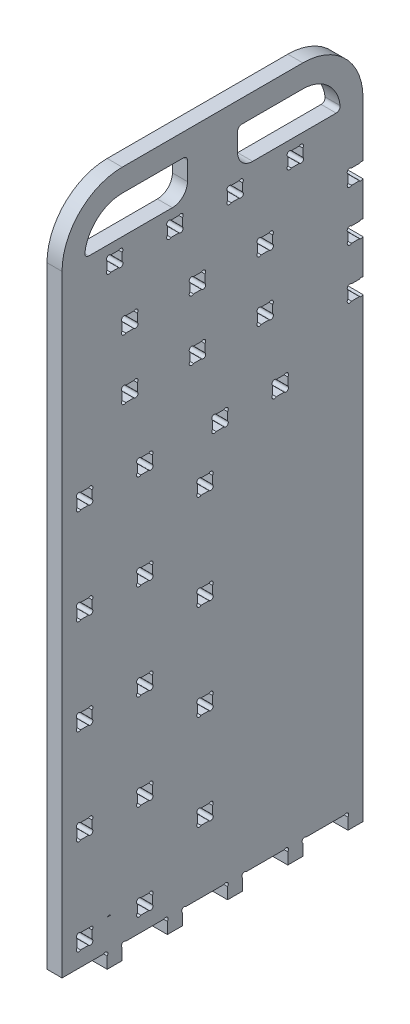
from build123d import *

# Parameters (mm, degrees)
BOSS_EXTRUDE1_DEPTH     = 19.05
CUT_EXTRUDE2_DEPTH      = 950.914156648
LPATTERN1_COUNT         = 5
LPATTERN1_PITCH         = 76.2
BOSS_EXTRUDE2_DEPTH     = 19.05
FILLET2_R               = 5.08
CUT_EXTRUDE3_DEPTH      = 950.914156648
CUT_EXTRUDE3_DEPTH_BACK = 950.914156648
FILLET3_R               = 19.05
SKETCH8_R               = 3.81
CUT_EXTRUDE4_DEPTH      = 45.72
BOSS_EXTRUDE3_START     = -19.05
SKETCH9_R               = 3.81
BOSS_EXTRUDE3_DEPTH     = 19.05
CUT_EXTRUDE5_DEPTH      = 950.914156648
CUT_EXTRUDE5_DEPTH_BACK = 950.914156648
CUT_EXTRUDE6_DEPTH      = 950.914156648
CUT_EXTRUDE6_DEPTH_BACK = 950.914156648
CUT_EXTRUDE7_DEPTH      = 950.914156648
CUT_EXTRUDE7_DEPTH_BACK = 950.914156648
BOSS_EXTRUDE4_START     = -19.05
BOSS_EXTRUDE4_DEPTH     = 19.05


with BuildPart() as part:
    # Sketch1 → Boss-Extrude1 (new body)
    with BuildSketch(Plane(origin=(0, 0, 0), x_dir=(0, 0, -1), z_dir=(1, 0, 0))):
        with BuildLine():
            Line((0, 793.75), (0, 0))
            Line((0, 0), (381, 0))
            Line((381, 0), (381, 793.75))
            ThreePointArc((381, 793.75), (358.681536726, 847.631536726), (304.8, 869.95))
            Line((304.8, 869.95), (76.2, 869.95))
            ThreePointArc((76.2, 869.95), (22.318463274, 847.631536726), (0, 793.75))
        make_face()
        with BuildLine():
            Line((57.15, 42.590128061), (57.15, 52.659871939))
            ThreePointArc((57.15, 52.659871939), (57.15, 57.15), (61.640128061, 57.15))
            Line((61.640128061, 57.15), (71.709871939, 57.15))
            ThreePointArc((71.709871939, 57.15), (76.2, 57.15), (76.2, 52.659871939))
            Line((76.2, 52.659871939), (76.2, 42.590128061))
            ThreePointArc((76.2, 42.590128061), (76.2, 38.1), (71.709871939, 38.1))
            Line((71.709871939, 38.1), (61.640128061, 38.1))
            ThreePointArc((61.640128061, 38.1), (57.15, 38.1), (57.15, 42.590128061))
        make_face(mode=Mode.SUBTRACT)
        with BuildLine():
            Line((76.2, 173.309871939), (76.2, 163.240128061))
            ThreePointArc((76.2, 163.240128061), (76.2, 158.75), (71.709871939, 158.75))
            Line((71.709871939, 158.75), (61.640128061, 158.75))
            ThreePointArc((61.640128061, 158.75), (57.15, 158.75), (57.15, 163.240128061))
            Line((57.15, 163.240128061), (57.15, 173.309871939))
            ThreePointArc((57.15, 173.309871939), (57.15, 177.8), (61.640128061, 177.8))
            Line((61.640128061, 177.8), (71.709871939, 177.8))
            ThreePointArc((71.709871939, 177.8), (76.2, 177.8), (76.2, 173.309871939))
        make_face(mode=Mode.SUBTRACT)
        with BuildLine():
            Line((137.840128061, 57.15), (147.909871939, 57.15))
            ThreePointArc((147.909871939, 57.15), (152.4, 57.15), (152.4, 52.659871939))
            Line((152.4, 52.659871939), (152.4, 42.590128061))
            ThreePointArc((152.4, 42.590128061), (152.4, 38.1), (147.909871939, 38.1))
            Line((147.909871939, 38.1), (137.840128061, 38.1))
            ThreePointArc((137.840128061, 38.1), (133.35, 38.1), (133.35, 42.590128061))
            Line((133.35, 42.590128061), (133.35, 52.659871939))
            ThreePointArc((133.35, 52.659871939), (133.35, 57.15), (137.840128061, 57.15))
        make_face(mode=Mode.SUBTRACT)
        with BuildLine():
            Line((171.45, 102.915128061), (171.45, 112.984871939))
            ThreePointArc((171.45, 112.984871939), (171.45, 117.475), (175.940128061, 117.475))
            Line((175.940128061, 117.475), (186.009871939, 117.475))
            ThreePointArc((186.009871939, 117.475), (190.5, 117.475), (190.5, 112.984871939))
            Line((190.5, 112.984871939), (190.5, 102.915128061))
            ThreePointArc((190.5, 102.915128061), (190.5, 98.425), (186.009871939, 98.425))
            Line((186.009871939, 98.425), (175.940128061, 98.425))
            ThreePointArc((175.940128061, 98.425), (171.45, 98.425), (171.45, 102.915128061))
        make_face(mode=Mode.SUBTRACT)
        with BuildLine():
            Line((152.4, 173.309871939), (152.4, 163.240128061))
            ThreePointArc((152.4, 163.240128061), (152.4, 158.75), (147.909871939, 158.75))
            Line((147.909871939, 158.75), (137.840128061, 158.75))
            ThreePointArc((137.840128061, 158.75), (133.35, 158.75), (133.35, 163.240128061))
            Line((133.35, 163.240128061), (133.35, 173.309871939))
            ThreePointArc((133.35, 173.309871939), (133.35, 177.8), (137.840128061, 177.8))
            Line((137.840128061, 177.8), (147.909871939, 177.8))
            ThreePointArc((147.909871939, 177.8), (152.4, 177.8), (152.4, 173.309871939))
        make_face(mode=Mode.SUBTRACT)
        with BuildLine():
            Line((190.5, 233.634871939), (190.5, 223.565128061))
            ThreePointArc((190.5, 223.565128061), (190.5, 219.075), (186.009871939, 219.075))
            Line((186.009871939, 219.075), (175.940128061, 219.075))
            ThreePointArc((175.940128061, 219.075), (171.45, 219.075), (171.45, 223.565128061))
            Line((171.45, 223.565128061), (171.45, 233.634871939))
            ThreePointArc((171.45, 233.634871939), (171.45, 238.125), (175.940128061, 238.125))
            Line((175.940128061, 238.125), (186.009871939, 238.125))
            ThreePointArc((186.009871939, 238.125), (190.5, 238.125), (190.5, 233.634871939))
        make_face(mode=Mode.SUBTRACT)
        with BuildLine():
            Line((76.2, 293.959871939), (76.2, 283.890128061))
            ThreePointArc((76.2, 283.890128061), (76.2, 279.4), (71.709871939, 279.4))
            Line((71.709871939, 279.4), (61.640128061, 279.4))
            ThreePointArc((61.640128061, 279.4), (57.15, 279.4), (57.15, 283.890128061))
            Line((57.15, 283.890128061), (57.15, 293.959871939))
            ThreePointArc((57.15, 293.959871939), (57.15, 298.45), (61.640128061, 298.45))
            Line((61.640128061, 298.45), (71.709871939, 298.45))
            ThreePointArc((71.709871939, 298.45), (76.2, 298.45), (76.2, 293.959871939))
        make_face(mode=Mode.SUBTRACT)
        with BuildLine():
            ThreePointArc((76.2, 404.540128061), (76.2, 400.05), (71.709871939, 400.05))
            Line((71.709871939, 400.05), (61.640128061, 400.05))
            ThreePointArc((61.640128061, 400.05), (57.15, 400.05), (57.15, 404.540128061))
            Line((57.15, 404.540128061), (57.15, 414.609871939))
            ThreePointArc((57.15, 414.609871939), (57.15, 419.1), (61.640128061, 419.1))
            Line((61.640128061, 419.1), (71.709871939, 419.1))
            ThreePointArc((71.709871939, 419.1), (76.2, 419.1), (76.2, 414.609871939))
            Line((76.2, 414.609871939), (76.2, 404.540128061))
        make_face(mode=Mode.SUBTRACT)
        with BuildLine():
            Line((152.4, 293.959871939), (152.4, 283.890128061))
            ThreePointArc((152.4, 283.890128061), (152.4, 279.4), (147.909871939, 279.4))
            Line((147.909871939, 279.4), (137.840128061, 279.4))
            ThreePointArc((137.840128061, 279.4), (133.35, 279.4), (133.35, 283.890128061))
            Line((133.35, 283.890128061), (133.35, 293.959871939))
            ThreePointArc((133.35, 293.959871939), (133.35, 298.45), (137.840128061, 298.45))
            Line((137.840128061, 298.45), (147.909871939, 298.45))
            ThreePointArc((147.909871939, 298.45), (152.4, 298.45), (152.4, 293.959871939))
        make_face(mode=Mode.SUBTRACT)
        with BuildLine():
            ThreePointArc((152.4, 404.540128061), (152.4, 400.05), (147.909871939, 400.05))
            Line((147.909871939, 400.05), (137.840128061, 400.05))
            ThreePointArc((137.840128061, 400.05), (133.35, 400.05), (133.35, 404.540128061))
            Line((133.35, 404.540128061), (133.35, 414.609871939))
            ThreePointArc((133.35, 414.609871939), (133.35, 419.1), (137.840128061, 419.1))
            Line((137.840128061, 419.1), (147.909871939, 419.1))
            ThreePointArc((147.909871939, 419.1), (152.4, 419.1), (152.4, 414.609871939))
            Line((152.4, 414.609871939), (152.4, 404.540128061))
        make_face(mode=Mode.SUBTRACT)
        with BuildLine():
            Line((190.5, 354.284871939), (190.5, 344.215128061))
            ThreePointArc((190.5, 344.215128061), (190.5, 339.725), (186.009871939, 339.725))
            Line((186.009871939, 339.725), (175.940128061, 339.725))
            ThreePointArc((175.940128061, 339.725), (171.45, 339.725), (171.45, 344.215128061))
            Line((171.45, 344.215128061), (171.45, 354.284871939))
            ThreePointArc((171.45, 354.284871939), (171.45, 358.775), (175.940128061, 358.775))
            Line((175.940128061, 358.775), (186.009871939, 358.775))
            ThreePointArc((186.009871939, 358.775), (190.5, 358.775), (190.5, 354.284871939))
        make_face(mode=Mode.SUBTRACT)
        with BuildLine():
            Line((61.640128061, 539.75), (71.709871939, 539.75))
            ThreePointArc((71.709871939, 539.75), (76.2, 539.75), (76.2, 535.259871939))
            Line((76.2, 535.259871939), (76.2, 525.190128061))
            ThreePointArc((76.2, 525.190128061), (76.2, 520.7), (71.709871939, 520.7))
            Line((71.709871939, 520.7), (61.640128061, 520.7))
            ThreePointArc((61.640128061, 520.7), (57.15, 520.7), (57.15, 525.190128061))
            Line((57.15, 525.190128061), (57.15, 535.259871939))
            ThreePointArc((57.15, 535.259871939), (57.15, 539.75), (61.640128061, 539.75))
        make_face(mode=Mode.SUBTRACT)
        with BuildLine():
            Line((137.840128061, 539.75), (147.909871939, 539.75))
            ThreePointArc((147.909871939, 539.75), (152.4, 539.75), (152.4, 535.259871939))
            Line((152.4, 535.259871939), (152.4, 525.190128061))
            ThreePointArc((152.4, 525.190128061), (152.4, 520.7), (147.909871939, 520.7))
            Line((147.909871939, 520.7), (137.840128061, 520.7))
            ThreePointArc((137.840128061, 520.7), (133.35, 520.7), (133.35, 525.190128061))
            Line((133.35, 525.190128061), (133.35, 535.259871939))
            ThreePointArc((133.35, 535.259871939), (133.35, 539.75), (137.840128061, 539.75))
        make_face(mode=Mode.SUBTRACT)
        with BuildLine():
            Line((190.5, 474.934871939), (190.5, 464.865128061))
            ThreePointArc((190.5, 464.865128061), (190.5, 460.375), (186.009871939, 460.375))
            Line((186.009871939, 460.375), (175.940128061, 460.375))
            ThreePointArc((175.940128061, 460.375), (171.45, 460.375), (171.45, 464.865128061))
            Line((171.45, 464.865128061), (171.45, 474.934871939))
            ThreePointArc((171.45, 474.934871939), (171.45, 479.425), (175.940128061, 479.425))
            Line((175.940128061, 479.425), (186.009871939, 479.425))
            ThreePointArc((186.009871939, 479.425), (190.5, 479.425), (190.5, 474.934871939))
        make_face(mode=Mode.SUBTRACT)
        with BuildLine():
            Line((61.640128061, 781.05), (71.709871939, 781.05))
            ThreePointArc((71.709871939, 781.05), (76.2, 781.05), (76.2, 776.559871939))
            Line((76.2, 776.559871939), (76.2, 766.490128061))
            ThreePointArc((76.2, 766.490128061), (76.2, 762), (71.709871939, 762))
            Line((71.709871939, 762), (61.640128061, 762))
            ThreePointArc((61.640128061, 762), (57.15, 762), (57.15, 766.490128061))
            Line((57.15, 766.490128061), (57.15, 776.559871939))
            ThreePointArc((57.15, 776.559871939), (57.15, 781.05), (61.640128061, 781.05))
        make_face(mode=Mode.SUBTRACT)
        with BuildLine():
            ThreePointArc((28.575, 793.75), (42.524039546, 827.425960454), (76.2, 841.375))
            Line((76.2, 841.375), (158.75, 841.375))
            Line((158.75, 841.375), (158.75, 793.75))
            Line((158.75, 793.75), (28.575, 793.75))
        make_face(mode=Mode.SUBTRACT)
        with BuildLine():
            Line((137.840128061, 781.05), (147.909871939, 781.05))
            ThreePointArc((147.909871939, 781.05), (152.4, 781.05), (152.4, 776.559871939))
            Line((152.4, 776.559871939), (152.4, 766.490128061))
            ThreePointArc((152.4, 766.490128061), (152.4, 762), (147.909871939, 762))
            Line((147.909871939, 762), (137.840128061, 762))
            ThreePointArc((137.840128061, 762), (133.35, 762), (133.35, 766.490128061))
            Line((133.35, 766.490128061), (133.35, 776.559871939))
            ThreePointArc((133.35, 776.559871939), (133.35, 781.05), (137.840128061, 781.05))
        make_face(mode=Mode.SUBTRACT)
        with BuildLine():
            Line((214.040128061, 781.05), (224.109871939, 781.05))
            ThreePointArc((224.109871939, 781.05), (228.6, 781.05), (228.6, 776.559871939))
            Line((228.6, 776.559871939), (228.6, 766.490128061))
            ThreePointArc((228.6, 766.490128061), (228.6, 762), (224.109871939, 762))
            Line((224.109871939, 762), (214.040128061, 762))
            ThreePointArc((214.040128061, 762), (209.55, 762), (209.55, 766.490128061))
            Line((209.55, 766.490128061), (209.55, 776.559871939))
            ThreePointArc((209.55, 776.559871939), (209.55, 781.05), (214.040128061, 781.05))
        make_face(mode=Mode.SUBTRACT)
        with BuildLine():
            Line((290.240128061, 781.05), (300.309871939, 781.05))
            ThreePointArc((300.309871939, 781.05), (304.8, 781.05), (304.8, 776.559871939))
            Line((304.8, 776.559871939), (304.8, 766.490128061))
            ThreePointArc((304.8, 766.490128061), (304.8, 762), (300.309871939, 762))
            Line((300.309871939, 762), (290.240128061, 762))
            ThreePointArc((290.240128061, 762), (285.75, 762), (285.75, 766.490128061))
            Line((285.75, 766.490128061), (285.75, 776.559871939))
            ThreePointArc((285.75, 776.559871939), (285.75, 781.05), (290.240128061, 781.05))
        make_face(mode=Mode.SUBTRACT)
        with BuildLine():
            Line((222.25, 793.75), (222.25, 841.375))
            Line((222.25, 841.375), (304.8, 841.375))
            ThreePointArc((304.8, 841.375), (338.475960454, 827.425960454), (352.425, 793.75))
            Line((352.425, 793.75), (222.25, 793.75))
        make_face(mode=Mode.SUBTRACT)
    extrude(amount=BOSS_EXTRUDE1_DEPTH)

    # Sketch4 → Cut-Extrude2 (cut, symmetric)
    with BuildSketch(Plane(origin=(19.05, 0, 0), x_dir=(0, 0, -1), z_dir=(1, 0, 0))):
        with BuildLine():
            Line((57.15, 14.559871939), (57.15, 4.490128061))
            Line((57.15, 4.490128061), (57.15, 0))
            Line((57.15, 0), (0, 0))
            Line((0, 0), (0, 14.559871939))
            ThreePointArc((0, 14.559871939), (0, 19.05), (4.490128061, 19.05))
            Line((4.490128061, 19.05), (52.659871939, 19.05))
            ThreePointArc((52.659871939, 19.05), (57.15, 19.05), (57.15, 14.559871939))
        make_face()
    cut_extrude2 = extrude(amount=CUT_EXTRUDE2_DEPTH, both=True, mode=Mode.SUBTRACT)

    # LPattern1: Cut-Extrude2 ×5
    with Locations(*[(0, 0, -i * LPATTERN1_PITCH) for i in range(1, LPATTERN1_COUNT)]):
        add(cut_extrude2, mode=Mode.SUBTRACT)

    # Sketch5 → Boss-Extrude2 (add)
    with BuildSketch(Plane(origin=(19.05, 0, 0), x_dir=(0, 0, -1), z_dir=(1, 0, 0))):
        with BuildLine():
            Line((0, 19.05), (4.490128061, 19.05))
            ThreePointArc((4.490128061, 19.05), (2.24506403, 19.97993597), (0, 19.05))
        make_face()
    extrude(amount=-BOSS_EXTRUDE2_DEPTH)

    # Fillet2
    fillet2_edges = [part.edges().sort_by_distance(p)[0] for p in [
        (9.525, 841.375, -158.75),
        (9.525, 793.75, -28.575),
        (9.525, 841.375, -222.25),
        (9.525, 793.75, -352.425),
    ]]
    fillet(fillet2_edges, radius=FILLET2_R)

    # Sketch6 → Cut-Extrude3 (cut, two sides: drawn at the far end of the back side and taken through both)
    with BuildSketch(Plane(origin=(19.05, 0, 0), x_dir=(0, 0, -1), z_dir=(1, 0, 0)).offset(-CUT_EXTRUDE3_DEPTH_BACK)):
        with BuildLine():
            Line((381, 645.840128061), (381, 655.909871939))
            ThreePointArc((381, 655.909871939), (381, 660.4), (376.509871939, 660.4))
            Line((376.509871939, 660.4), (366.440128061, 660.4))
            ThreePointArc((366.440128061, 660.4), (361.95, 660.4), (361.95, 655.909871939))
            Line((361.95, 655.909871939), (361.95, 645.840128061))
            ThreePointArc((361.95, 645.840128061), (361.95, 641.35), (366.440128061, 641.35))
            Line((366.440128061, 641.35), (376.509871939, 641.35))
            ThreePointArc((376.509871939, 641.35), (381, 641.35), (381, 645.840128061))
        make_face()
        with BuildLine():
            Line((381, 582.340128061), (381, 592.409871939))
            ThreePointArc((381, 592.409871939), (381, 596.9), (376.509871939, 596.9))
            Line((376.509871939, 596.9), (366.440128061, 596.9))
            ThreePointArc((366.440128061, 596.9), (361.95, 596.9), (361.95, 592.409871939))
            Line((361.95, 592.409871939), (361.95, 582.340128061))
            ThreePointArc((361.95, 582.340128061), (361.95, 577.85), (366.440128061, 577.85))
            Line((366.440128061, 577.85), (376.509871939, 577.85))
            ThreePointArc((376.509871939, 577.85), (381, 577.85), (381, 582.340128061))
        make_face()
        with BuildLine():
            Line((381, 709.340128061), (381, 719.409871939))
            ThreePointArc((381, 719.409871939), (381, 723.9), (376.509871939, 723.9))
            Line((376.509871939, 723.9), (366.440128061, 723.9))
            ThreePointArc((366.440128061, 723.9), (361.95, 723.9), (361.95, 719.409871939))
            Line((361.95, 719.409871939), (361.95, 709.340128061))
            ThreePointArc((361.95, 709.340128061), (361.95, 704.85), (366.440128061, 704.85))
            Line((366.440128061, 704.85), (376.509871939, 704.85))
            ThreePointArc((376.509871939, 704.85), (381, 704.85), (381, 709.340128061))
        make_face()
    extrude(amount=CUT_EXTRUDE3_DEPTH + CUT_EXTRUDE3_DEPTH_BACK, mode=Mode.SUBTRACT)

    # Fillet3
    fillet3_edges = [part.edges().sort_by_distance(p)[0] for p in [
        (9.525, 793.75, -158.75),
        (9.525, 793.75, -222.25),
    ]]
    fillet(fillet3_edges, radius=FILLET3_R)

    # Sketch8 → Cut-Extrude4 (cut)
    with BuildSketch(Plane(origin=(0, 0, 0), x_dir=(0, 0, -1), z_dir=(1, 0, 0))):
        with Locations((288.163831373, 502.508233844)):
            Circle(SKETCH8_R)
        with Locations((288.163831373, 322.168233844)):
            Circle(SKETCH8_R)
        with Locations((288.163831373, 231.849411281)):
            Circle(SKETCH8_R)
        with Locations((288.163831373, 51.509411281)):
            Circle(SKETCH8_R)
        with Locations((334.581915687, 28.649411281)):
            Circle(SKETCH8_R)
        with Locations((334.581915687, 257.249411281)):
            Circle(SKETCH8_R)
        with Locations(Location((334.581915687, 525.368233844, 0), (0, 0, 180))):
            Circle(SKETCH8_R)
        with Locations(Location((334.581915687, 296.768233844, 0), (0, 0, 180))):
            Circle(SKETCH8_R)
        with Locations(Location((241.74574706, 28.649411281, 0), (0, 0, 180))):
            Circle(SKETCH8_R)
        with Locations(Location((241.74574706, 257.249411281, 0), (0, 0, 180))):
            Circle(SKETCH8_R)
        with Locations((241.74574706, 296.768233844)):
            Circle(SKETCH8_R)
        with Locations((241.74574706, 525.368233844)):
            Circle(SKETCH8_R)
    extrude(amount=CUT_EXTRUDE4_DEPTH, mode=Mode.SUBTRACT)

    # Sketch9 → Boss-Extrude3 (add)
    with BuildSketch(Plane(origin=(19.05, 0, 0), x_dir=(0, 0, -1), z_dir=(1, 0, 0)).offset(BOSS_EXTRUDE3_START)):
        with Locations((241.74574706, 525.368233844)):
            Circle(SKETCH9_R)
        with Locations((334.581915687, 525.368233844)):
            Circle(SKETCH9_R)
        with Locations((288.163831373, 502.508233844)):
            Circle(SKETCH9_R)
        with Locations((241.74574706, 296.768233844)):
            Circle(SKETCH9_R)
        with Locations((334.581915687, 296.768233844)):
            Circle(SKETCH9_R)
        with Locations((288.163831373, 322.168233844)):
            Circle(SKETCH9_R)
        with Locations((241.74574706, 257.249411281)):
            Circle(SKETCH9_R)
        with Locations((288.163831373, 231.849411281)):
            Circle(SKETCH9_R)
        with Locations((334.581915687, 257.249411281)):
            Circle(SKETCH9_R)
        with Locations((241.74574706, 28.649411281)):
            Circle(SKETCH9_R)
        with Locations((288.163831373, 51.509411281)):
            Circle(SKETCH9_R)
        with Locations((334.581915687, 28.649411281)):
            Circle(SKETCH9_R)
    extrude(amount=BOSS_EXTRUDE3_DEPTH)

    # Sketch10 → Cut-Extrude5 (cut, two sides: drawn at the far end of the back side and taken through both)
    with BuildSketch(Plane.ZY.offset(-CUT_EXTRUDE5_DEPTH_BACK)):
        with BuildLine():
            Line((-90.759871939, 685.8), (-80.690128061, 685.8))
            ThreePointArc((-80.690128061, 685.8), (-76.2, 685.8), (-76.2, 690.290128061))
            Line((-76.2, 690.290128061), (-76.2, 700.359871939))
            ThreePointArc((-76.2, 700.359871939), (-76.2, 704.85), (-80.690128061, 704.85))
            Line((-80.690128061, 704.85), (-90.759871939, 704.85))
            ThreePointArc((-90.759871939, 704.85), (-95.25, 704.85), (-95.25, 700.359871939))
            Line((-95.25, 700.359871939), (-95.25, 690.290128061))
            ThreePointArc((-95.25, 690.290128061), (-95.25, 685.8), (-90.759871939, 685.8))
        make_face()
        with BuildLine():
            Line((-180.975, 690.290128061), (-180.975, 700.359871939))
            ThreePointArc((-180.975, 700.359871939), (-180.975, 704.85), (-176.484871939, 704.85))
            Line((-176.484871939, 704.85), (-166.415128061, 704.85))
            ThreePointArc((-166.415128061, 704.85), (-161.925, 704.85), (-161.925, 700.359871939))
            Line((-161.925, 700.359871939), (-161.925, 690.290128061))
            ThreePointArc((-161.925, 690.290128061), (-161.925, 685.8), (-166.415128061, 685.8))
            Line((-166.415128061, 685.8), (-176.484871939, 685.8))
            ThreePointArc((-176.484871939, 685.8), (-180.975, 685.8), (-180.975, 690.290128061))
        make_face()
        with BuildLine():
            Line((-266.7, 690.290128061), (-266.7, 700.359871939))
            ThreePointArc((-266.7, 700.359871939), (-266.7, 704.85), (-262.209871939, 704.85))
            Line((-262.209871939, 704.85), (-252.140128061, 704.85))
            ThreePointArc((-252.140128061, 704.85), (-247.65, 704.85), (-247.65, 700.359871939))
            Line((-247.65, 700.359871939), (-247.65, 690.290128061))
            ThreePointArc((-247.65, 690.290128061), (-247.65, 685.8), (-252.140128061, 685.8))
            Line((-252.140128061, 685.8), (-262.209871939, 685.8))
            ThreePointArc((-262.209871939, 685.8), (-266.7, 685.8), (-266.7, 690.290128061))
        make_face()
        with BuildLine():
            Line((-180.975, 614.090128061), (-180.975, 624.159871939))
            ThreePointArc((-180.975, 624.159871939), (-180.975, 628.65), (-176.484871939, 628.65))
            Line((-176.484871939, 628.65), (-166.415128061, 628.65))
            ThreePointArc((-166.415128061, 628.65), (-161.925, 628.65), (-161.925, 624.159871939))
            Line((-161.925, 624.159871939), (-161.925, 614.090128061))
            ThreePointArc((-161.925, 614.090128061), (-161.925, 609.6), (-166.415128061, 609.6))
            Line((-166.415128061, 609.6), (-176.484871939, 609.6))
            ThreePointArc((-176.484871939, 609.6), (-180.975, 609.6), (-180.975, 614.090128061))
        make_face()
        with BuildLine():
            Line((-266.7, 614.090128061), (-266.7, 624.159871939))
            ThreePointArc((-266.7, 624.159871939), (-266.7, 628.65), (-262.209871939, 628.65))
            Line((-262.209871939, 628.65), (-252.140128061, 628.65))
            ThreePointArc((-252.140128061, 628.65), (-247.65, 628.65), (-247.65, 624.159871939))
            Line((-247.65, 624.159871939), (-247.65, 614.090128061))
            ThreePointArc((-247.65, 614.090128061), (-247.65, 609.6), (-252.140128061, 609.6))
            Line((-252.140128061, 609.6), (-262.209871939, 609.6))
            ThreePointArc((-262.209871939, 609.6), (-266.7, 609.6), (-266.7, 614.090128061))
        make_face()
        with BuildLine():
            Line((-95.25, 614.090128061), (-95.25, 624.159871939))
            ThreePointArc((-95.25, 624.159871939), (-95.25, 628.65), (-90.759871939, 628.65))
            Line((-90.759871939, 628.65), (-80.690128061, 628.65))
            ThreePointArc((-80.690128061, 628.65), (-76.2, 628.65), (-76.2, 624.159871939))
            Line((-76.2, 624.159871939), (-76.2, 614.090128061))
            ThreePointArc((-76.2, 614.090128061), (-76.2, 609.6), (-80.690128061, 609.6))
            Line((-80.690128061, 609.6), (-90.759871939, 609.6))
            ThreePointArc((-90.759871939, 609.6), (-95.25, 609.6), (-95.25, 614.090128061))
        make_face()
    extrude(amount=CUT_EXTRUDE5_DEPTH + CUT_EXTRUDE5_DEPTH_BACK, mode=Mode.SUBTRACT)

    # Sketch11 → Cut-Extrude6 (cut, two sides: drawn at the far end of the back side and taken through both)
    with BuildSketch(Plane(origin=(19.05, 0, 0), x_dir=(0, 0, -1), z_dir=(1, 0, 0)).offset(-CUT_EXTRUDE6_DEPTH_BACK)):
        with BuildLine():
            Line((228.6, 525.190128061), (228.6, 535.259871939))
            ThreePointArc((228.6, 535.259871939), (228.6, 539.75), (233.090128061, 539.75))
            Line((233.090128061, 539.75), (243.159871939, 539.75))
            ThreePointArc((243.159871939, 539.75), (247.65, 539.75), (247.65, 535.259871939))
            Line((247.65, 535.259871939), (247.65, 525.190128061))
            ThreePointArc((247.65, 525.190128061), (247.65, 520.7), (243.159871939, 520.7))
            Line((243.159871939, 520.7), (233.090128061, 520.7))
            ThreePointArc((233.090128061, 520.7), (228.6, 520.7), (228.6, 525.190128061))
        make_face()
        with BuildLine():
            Line((304.8, 525.190128061), (304.8, 535.259871939))
            ThreePointArc((304.8, 535.259871939), (304.8, 539.75), (309.290128061, 539.75))
            Line((309.290128061, 539.75), (319.359871939, 539.75))
            ThreePointArc((319.359871939, 539.75), (323.85, 539.75), (323.85, 535.259871939))
            Line((323.85, 535.259871939), (323.85, 525.190128061))
            ThreePointArc((323.85, 525.190128061), (323.85, 520.7), (319.359871939, 520.7))
            Line((319.359871939, 520.7), (309.290128061, 520.7))
            ThreePointArc((309.290128061, 520.7), (304.8, 520.7), (304.8, 525.190128061))
        make_face()
    extrude(amount=CUT_EXTRUDE6_DEPTH + CUT_EXTRUDE6_DEPTH_BACK, mode=Mode.SUBTRACT)

    # Sketch12 → Cut-Extrude7 (cut, two sides: drawn at the far end of the back side and taken through both)
    with BuildSketch(Plane(origin=(19.05, 0, 0), x_dir=(0, 0, -1), z_dir=(1, 0, 0)).offset(-CUT_EXTRUDE7_DEPTH_BACK)):
        with BuildLine():
            Line((281.259871939, 539.75), (271.190128061, 539.75))
            ThreePointArc((271.190128061, 539.75), (266.7, 539.75), (266.7, 535.259871939))
            Line((266.7, 535.259871939), (266.7, 525.190128061))
            ThreePointArc((266.7, 525.190128061), (266.7, 520.7), (271.190128061, 520.7))
            Line((271.190128061, 520.7), (281.259871939, 520.7))
            ThreePointArc((281.259871939, 520.7), (285.75, 520.7), (285.75, 525.190128061))
            Line((285.75, 525.190128061), (285.75, 535.259871939))
            ThreePointArc((285.75, 535.259871939), (285.75, 539.75), (281.259871939, 539.75))
        make_face()
        with BuildLine():
            Line((194.990128061, 520.7), (205.059871939, 520.7))
            ThreePointArc((205.059871939, 520.7), (209.55, 520.7), (209.55, 525.190128061))
            Line((209.55, 525.190128061), (209.55, 535.259871939))
            ThreePointArc((209.55, 535.259871939), (209.55, 539.75), (205.059871939, 539.75))
            Line((205.059871939, 539.75), (194.990128061, 539.75))
            ThreePointArc((194.990128061, 539.75), (190.5, 539.75), (190.5, 535.259871939))
            Line((190.5, 535.259871939), (190.5, 525.190128061))
            ThreePointArc((190.5, 525.190128061), (190.5, 520.7), (194.990128061, 520.7))
        make_face()
        with BuildLine():
            Line((99.740128061, 520.7), (109.809871939, 520.7))
            ThreePointArc((109.809871939, 520.7), (114.3, 520.7), (114.3, 525.190128061))
            Line((114.3, 525.190128061), (114.3, 535.259871939))
            ThreePointArc((114.3, 535.259871939), (114.3, 539.75), (109.809871939, 539.75))
            Line((109.809871939, 539.75), (99.740128061, 539.75))
            ThreePointArc((99.740128061, 539.75), (95.25, 539.75), (95.25, 535.259871939))
            Line((95.25, 535.259871939), (95.25, 525.190128061))
            ThreePointArc((95.25, 525.190128061), (95.25, 520.7), (99.740128061, 520.7))
        make_face()
        with BuildLine():
            Line((23.540128061, 520.7), (33.609871939, 520.7))
            ThreePointArc((33.609871939, 520.7), (38.1, 520.7), (38.1, 525.190128061))
            Line((38.1, 525.190128061), (38.1, 535.259871939))
            ThreePointArc((38.1, 535.259871939), (38.1, 539.75), (33.609871939, 539.75))
            Line((33.609871939, 539.75), (23.540128061, 539.75))
            ThreePointArc((23.540128061, 539.75), (19.05, 539.75), (19.05, 535.259871939))
            Line((19.05, 535.259871939), (19.05, 525.190128061))
            ThreePointArc((19.05, 525.190128061), (19.05, 520.7), (23.540128061, 520.7))
        make_face()
        with BuildLine():
            Line((99.740128061, 400.05), (109.809871939, 400.05))
            ThreePointArc((109.809871939, 400.05), (114.3, 400.05), (114.3, 404.540128061))
            Line((114.3, 404.540128061), (114.3, 414.609871939))
            ThreePointArc((114.3, 414.609871939), (114.3, 419.1), (109.809871939, 419.1))
            Line((109.809871939, 419.1), (99.740128061, 419.1))
            ThreePointArc((99.740128061, 419.1), (95.25, 419.1), (95.25, 414.609871939))
            Line((95.25, 414.609871939), (95.25, 404.540128061))
            ThreePointArc((95.25, 404.540128061), (95.25, 400.05), (99.740128061, 400.05))
        make_face()
        with BuildLine():
            Line((23.540128061, 400.05), (33.609871939, 400.05))
            ThreePointArc((33.609871939, 400.05), (38.1, 400.05), (38.1, 404.540128061))
            Line((38.1, 404.540128061), (38.1, 414.609871939))
            ThreePointArc((38.1, 414.609871939), (38.1, 419.1), (33.609871939, 419.1))
            Line((33.609871939, 419.1), (23.540128061, 419.1))
            ThreePointArc((23.540128061, 419.1), (19.05, 419.1), (19.05, 414.609871939))
            Line((19.05, 414.609871939), (19.05, 404.540128061))
            ThreePointArc((19.05, 404.540128061), (19.05, 400.05), (23.540128061, 400.05))
        make_face()
        with BuildLine():
            Line((99.740128061, 279.4), (109.809871939, 279.4))
            ThreePointArc((109.809871939, 279.4), (114.3, 279.4), (114.3, 283.890128061))
            Line((114.3, 283.890128061), (114.3, 293.959871939))
            ThreePointArc((114.3, 293.959871939), (114.3, 298.45), (109.809871939, 298.45))
            Line((109.809871939, 298.45), (99.740128061, 298.45))
            ThreePointArc((99.740128061, 298.45), (95.25, 298.45), (95.25, 293.959871939))
            Line((95.25, 293.959871939), (95.25, 283.890128061))
            ThreePointArc((95.25, 283.890128061), (95.25, 279.4), (99.740128061, 279.4))
        make_face()
        with BuildLine():
            Line((23.540128061, 279.4), (33.609871939, 279.4))
            ThreePointArc((33.609871939, 279.4), (38.1, 279.4), (38.1, 283.890128061))
            Line((38.1, 283.890128061), (38.1, 293.959871939))
            ThreePointArc((38.1, 293.959871939), (38.1, 298.45), (33.609871939, 298.45))
            Line((33.609871939, 298.45), (23.540128061, 298.45))
            ThreePointArc((23.540128061, 298.45), (19.05, 298.45), (19.05, 293.959871939))
            Line((19.05, 293.959871939), (19.05, 283.890128061))
            ThreePointArc((19.05, 283.890128061), (19.05, 279.4), (23.540128061, 279.4))
        make_face()
        with BuildLine():
            Line((99.740128061, 158.75), (109.809871939, 158.75))
            ThreePointArc((109.809871939, 158.75), (114.3, 158.75), (114.3, 163.240128061))
            Line((114.3, 163.240128061), (114.3, 173.309871939))
            ThreePointArc((114.3, 173.309871939), (114.3, 177.8), (109.809871939, 177.8))
            Line((109.809871939, 177.8), (99.740128061, 177.8))
            ThreePointArc((99.740128061, 177.8), (95.25, 177.8), (95.25, 173.309871939))
            Line((95.25, 173.309871939), (95.25, 163.240128061))
            ThreePointArc((95.25, 163.240128061), (95.25, 158.75), (99.740128061, 158.75))
        make_face()
        with BuildLine():
            Line((23.540128061, 158.75), (33.609871939, 158.75))
            ThreePointArc((33.609871939, 158.75), (38.1, 158.75), (38.1, 163.240128061))
            Line((38.1, 163.240128061), (38.1, 173.309871939))
            ThreePointArc((38.1, 173.309871939), (38.1, 177.8), (33.609871939, 177.8))
            Line((33.609871939, 177.8), (23.540128061, 177.8))
            ThreePointArc((23.540128061, 177.8), (19.05, 177.8), (19.05, 173.309871939))
            Line((19.05, 173.309871939), (19.05, 163.240128061))
            ThreePointArc((19.05, 163.240128061), (19.05, 158.75), (23.540128061, 158.75))
        make_face()
        with BuildLine():
            Line((99.740128061, 38.1), (109.809871939, 38.1))
            ThreePointArc((109.809871939, 38.1), (114.3, 38.1), (114.3, 42.590128061))
            Line((114.3, 42.590128061), (114.3, 52.659871939))
            ThreePointArc((114.3, 52.659871939), (114.3, 57.15), (109.809871939, 57.15))
            Line((109.809871939, 57.15), (99.740128061, 57.15))
            ThreePointArc((99.740128061, 57.15), (95.25, 57.15), (95.25, 52.659871939))
            Line((95.25, 52.659871939), (95.25, 42.590128061))
            ThreePointArc((95.25, 42.590128061), (95.25, 38.1), (99.740128061, 38.1))
        make_face()
        with BuildLine():
            Line((38.1, 57.15), (33.609871939, 57.15))
            Line((33.609871939, 57.15), (23.540128061, 57.15))
            ThreePointArc((23.540128061, 57.15), (19.05, 57.15), (19.05, 52.659871939))
            Line((19.05, 52.659871939), (19.05, 42.590128061))
            ThreePointArc((19.05, 42.590128061), (19.05, 38.1), (23.540128061, 38.1))
            Line((23.540128061, 38.1), (33.609871939, 38.1))
            ThreePointArc((33.609871939, 38.1), (38.1, 38.1), (38.1, 42.590128061))
            Line((38.1, 42.590128061), (38.1, 52.659871939))
            ThreePointArc((38.1, 52.659871939), (39.02993597, 54.90493597), (38.1, 57.15))
        make_face()
    extrude(amount=CUT_EXTRUDE7_DEPTH + CUT_EXTRUDE7_DEPTH_BACK, mode=Mode.SUBTRACT)

    # Sketch12<3> → Boss-Extrude4 (add)
    with BuildSketch(Plane(origin=(19.05, 0, 0), x_dir=(0, 0, -1), z_dir=(1, 0, 0)).offset(BOSS_EXTRUDE4_START)):
        with BuildLine():
            Line((61.640128061, 520.7), (71.709871939, 520.7))
            ThreePointArc((71.709871939, 520.7), (76.2, 520.7), (76.2, 525.190128061))
            Line((76.2, 525.190128061), (76.2, 535.259871939))
            ThreePointArc((76.2, 535.259871939), (76.2, 539.75), (71.709871939, 539.75))
            Line((71.709871939, 539.75), (61.640128061, 539.75))
            ThreePointArc((61.640128061, 539.75), (57.15, 539.75), (57.15, 535.259871939))
            Line((57.15, 535.259871939), (57.15, 525.190128061))
            ThreePointArc((57.15, 525.190128061), (57.15, 520.7), (61.640128061, 520.7))
        make_face()
        with BuildLine():
            Line((137.840128061, 520.7), (147.909871939, 520.7))
            ThreePointArc((147.909871939, 520.7), (152.4, 520.7), (152.4, 525.190128061))
            Line((152.4, 525.190128061), (152.4, 535.259871939))
            ThreePointArc((152.4, 535.259871939), (152.4, 539.75), (147.909871939, 539.75))
            Line((147.909871939, 539.75), (137.840128061, 539.75))
            ThreePointArc((137.840128061, 539.75), (133.35, 539.75), (133.35, 535.259871939))
            Line((133.35, 535.259871939), (133.35, 525.190128061))
            ThreePointArc((133.35, 525.190128061), (133.35, 520.7), (137.840128061, 520.7))
        make_face()
        with BuildLine():
            Line((233.090128061, 520.7), (243.159871939, 520.7))
            ThreePointArc((243.159871939, 520.7), (247.65, 520.7), (247.65, 525.190128061))
            Line((247.65, 525.190128061), (247.65, 535.259871939))
            ThreePointArc((247.65, 535.259871939), (247.65, 539.75), (243.159871939, 539.75))
            Line((243.159871939, 539.75), (233.090128061, 539.75))
            ThreePointArc((233.090128061, 539.75), (228.6, 539.75), (228.6, 535.259871939))
            Line((228.6, 535.259871939), (228.6, 525.190128061))
            ThreePointArc((228.6, 525.190128061), (228.6, 520.7), (233.090128061, 520.7))
        make_face()
        with BuildLine():
            Line((319.359871939, 539.75), (309.290128061, 539.75))
            ThreePointArc((309.290128061, 539.75), (304.8, 539.75), (304.8, 535.259871939))
            Line((304.8, 535.259871939), (304.8, 525.190128061))
            ThreePointArc((304.8, 525.190128061), (304.8, 520.7), (309.290128061, 520.7))
            Line((309.290128061, 520.7), (319.359871939, 520.7))
            ThreePointArc((319.359871939, 520.7), (323.85, 520.7), (323.85, 525.190128061))
            Line((323.85, 525.190128061), (323.85, 535.259871939))
            ThreePointArc((323.85, 535.259871939), (323.85, 539.75), (319.359871939, 539.75))
        make_face()
        with BuildLine():
            Line((61.640128061, 400.05), (71.709871939, 400.05))
            ThreePointArc((71.709871939, 400.05), (76.2, 400.05), (76.2, 404.540128061))
            Line((76.2, 404.540128061), (76.2, 414.609871939))
            ThreePointArc((76.2, 414.609871939), (76.2, 419.1), (71.709871939, 419.1))
            Line((71.709871939, 419.1), (61.640128061, 419.1))
            ThreePointArc((61.640128061, 419.1), (57.15, 419.1), (57.15, 414.609871939))
            Line((57.15, 414.609871939), (57.15, 404.540128061))
            ThreePointArc((57.15, 404.540128061), (57.15, 400.05), (61.640128061, 400.05))
        make_face()
        with BuildLine():
            Line((137.840128061, 400.05), (147.909871939, 400.05))
            ThreePointArc((147.909871939, 400.05), (152.4, 400.05), (152.4, 404.540128061))
            Line((152.4, 404.540128061), (152.4, 414.609871939))
            ThreePointArc((152.4, 414.609871939), (152.4, 419.1), (147.909871939, 419.1))
            Line((147.909871939, 419.1), (137.840128061, 419.1))
            ThreePointArc((137.840128061, 419.1), (133.35, 419.1), (133.35, 414.609871939))
            Line((133.35, 414.609871939), (133.35, 404.540128061))
            ThreePointArc((133.35, 404.540128061), (133.35, 400.05), (137.840128061, 400.05))
        make_face()
        with BuildLine():
            Line((61.640128061, 279.4), (71.709871939, 279.4))
            ThreePointArc((71.709871939, 279.4), (76.2, 279.4), (76.2, 283.890128061))
            Line((76.2, 283.890128061), (76.2, 293.959871939))
            ThreePointArc((76.2, 293.959871939), (76.2, 298.45), (71.709871939, 298.45))
            Line((71.709871939, 298.45), (61.640128061, 298.45))
            ThreePointArc((61.640128061, 298.45), (57.15, 298.45), (57.15, 293.959871939))
            Line((57.15, 293.959871939), (57.15, 283.890128061))
            ThreePointArc((57.15, 283.890128061), (57.15, 279.4), (61.640128061, 279.4))
        make_face()
        with BuildLine():
            Line((137.840128061, 279.4), (147.909871939, 279.4))
            ThreePointArc((147.909871939, 279.4), (152.4, 279.4), (152.4, 283.890128061))
            Line((152.4, 283.890128061), (152.4, 293.959871939))
            ThreePointArc((152.4, 293.959871939), (152.4, 298.45), (147.909871939, 298.45))
            Line((147.909871939, 298.45), (137.840128061, 298.45))
            ThreePointArc((137.840128061, 298.45), (133.35, 298.45), (133.35, 293.959871939))
            Line((133.35, 293.959871939), (133.35, 283.890128061))
            ThreePointArc((133.35, 283.890128061), (133.35, 279.4), (137.840128061, 279.4))
        make_face()
        with BuildLine():
            Line((61.640128061, 158.75), (71.709871939, 158.75))
            ThreePointArc((71.709871939, 158.75), (76.2, 158.75), (76.2, 163.240128061))
            Line((76.2, 163.240128061), (76.2, 173.309871939))
            ThreePointArc((76.2, 173.309871939), (76.2, 177.8), (71.709871939, 177.8))
            Line((71.709871939, 177.8), (61.640128061, 177.8))
            ThreePointArc((61.640128061, 177.8), (57.15, 177.8), (57.15, 173.309871939))
            Line((57.15, 173.309871939), (57.15, 163.240128061))
            ThreePointArc((57.15, 163.240128061), (57.15, 158.75), (61.640128061, 158.75))
        make_face()
        with BuildLine():
            Line((61.640128061, 57.15), (57.15, 57.15))
            ThreePointArc((57.15, 57.15), (56.22006403, 54.90493597), (57.15, 52.659871939))
            Line((57.15, 52.659871939), (57.15, 42.590128061))
            ThreePointArc((57.15, 42.590128061), (57.15, 38.1), (61.640128061, 38.1))
            Line((61.640128061, 38.1), (71.709871939, 38.1))
            ThreePointArc((71.709871939, 38.1), (76.2, 38.1), (76.2, 42.590128061))
            Line((76.2, 42.590128061), (76.2, 52.659871939))
            ThreePointArc((76.2, 52.659871939), (76.2, 57.15), (71.709871939, 57.15))
            Line((71.709871939, 57.15), (61.640128061, 57.15))
        make_face()
        with BuildLine():
            Line((137.840128061, 158.75), (147.909871939, 158.75))
            ThreePointArc((147.909871939, 158.75), (152.4, 158.75), (152.4, 163.240128061))
            Line((152.4, 163.240128061), (152.4, 173.309871939))
            ThreePointArc((152.4, 173.309871939), (152.4, 177.8), (147.909871939, 177.8))
            Line((147.909871939, 177.8), (137.840128061, 177.8))
            ThreePointArc((137.840128061, 177.8), (133.35, 177.8), (133.35, 173.309871939))
            Line((133.35, 173.309871939), (133.35, 163.240128061))
            ThreePointArc((133.35, 163.240128061), (133.35, 158.75), (137.840128061, 158.75))
        make_face()
        with BuildLine():
            Line((137.840128061, 38.1), (147.909871939, 38.1))
            ThreePointArc((147.909871939, 38.1), (152.4, 38.1), (152.4, 42.590128061))
            Line((152.4, 42.590128061), (152.4, 52.659871939))
            ThreePointArc((152.4, 52.659871939), (152.4, 57.15), (147.909871939, 57.15))
            Line((147.909871939, 57.15), (137.840128061, 57.15))
            ThreePointArc((137.840128061, 57.15), (133.35, 57.15), (133.35, 52.659871939))
            Line((133.35, 52.659871939), (133.35, 42.590128061))
            ThreePointArc((133.35, 42.590128061), (133.35, 38.1), (137.840128061, 38.1))
        make_face()
    extrude(amount=BOSS_EXTRUDE4_DEPTH)


solid = part.part
